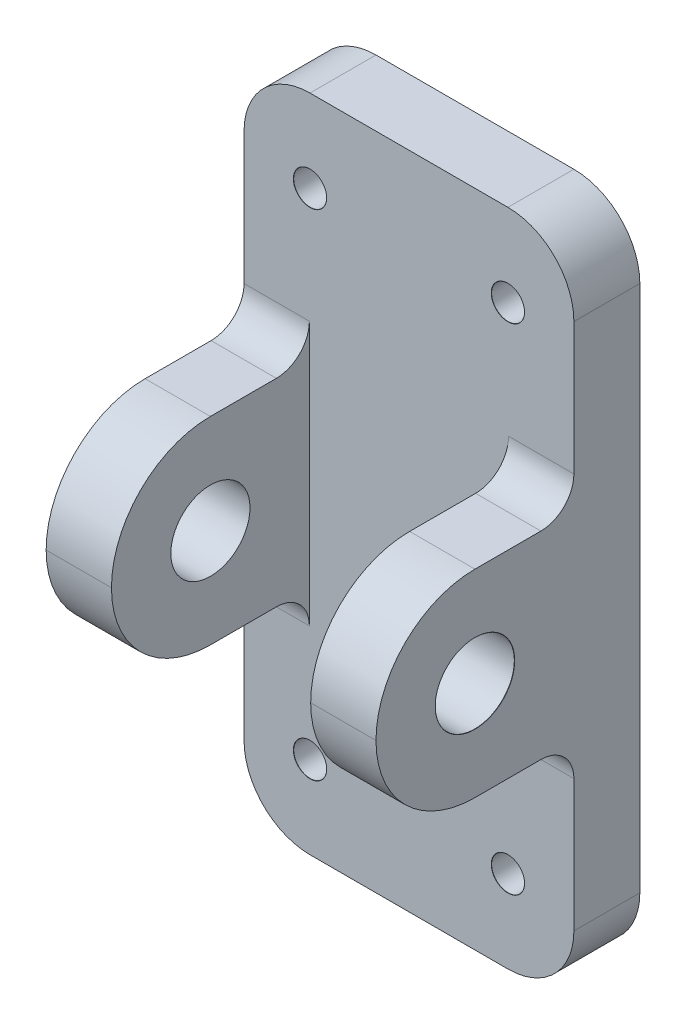
from build123d import *

# Parameters (mm, degrees)
SKETCH1_W                        = 100
SKETCH1_H                        = 50
BOSS_EXTRUDE1_DEPTH              = 10
SKETCH2_W                        = 30
SKETCH2_H                        = 9.9
BOSS_EXTRUDE2_DEPTH              = 30
FILLET1_R                        = 15
F_12_0MM_DOWEL_HOLE1_D           = 12
F_12_0MM_DOWEL_HOLE1_CSINK_D     = 12.05
F_12_0MM_DOWEL_HOLE1_CSINK_ANGLE = 90
F_5_0MM_DOWEL_HOLE1_D            = 5
F_5_0MM_DOWEL_HOLE1_CSINK_D      = 5.05
F_5_0MM_DOWEL_HOLE1_CSINK_ANGLE  = 90
FILLET2_R                        = 5
FILLET3_R                        = 10


with BuildPart() as part:
    # Sketch1 → Boss-Extrude1 (new body)
    with BuildSketch(Plane(origin=(0, 0, 0), x_dir=(0, 1, 0), z_dir=(0, 0, 1))):
        Rectangle(SKETCH1_W, SKETCH1_H)
    extrude(amount=-BOSS_EXTRUDE1_DEPTH)

    # Sketch2 → Boss-Extrude2 (add)
    with BuildSketch(Plane(origin=(0, 0, 0), x_dir=(0, 1, 0), z_dir=(0, 0, 1))):
        with Locations((0, 20.05)):
            Rectangle(SKETCH2_W, SKETCH2_H)
        with Locations((0, -20.05)):
            Rectangle(SKETCH2_W, SKETCH2_H)
    extrude(amount=BOSS_EXTRUDE2_DEPTH)

    # Fillet1
    fillet1_edges = [part.edges().sort_by_distance(p)[0] for p in [
        (20.05, 15, 30),
        (20.05, -15, 30),
        (-20.05, 15, 30),
        (-20.05, -15, 30),
    ]]
    fillet(fillet1_edges, radius=FILLET1_R - 0.0001)  # a hair under: the kernel refuses the full size

    # Ø12.0mm Dowel Hole1 (through all)
    with Locations(Plane.YZ.offset(25)):
        with Locations((0, 15)):
            CounterSinkHole(F_12_0MM_DOWEL_HOLE1_D / 2, F_12_0MM_DOWEL_HOLE1_CSINK_D / 2, counter_sink_angle=F_12_0MM_DOWEL_HOLE1_CSINK_ANGLE)

    # Ø5.0mm Dowel Hole1 (through all)
    with Locations(Plane(origin=(0, 0, 0), x_dir=(0, 1, 0), z_dir=(0, 0, 1))):
        with Locations((37.5, -15), (-37.5, 15), (-37.5, -15), (37.5, 15)):
            CounterSinkHole(F_5_0MM_DOWEL_HOLE1_D / 2, F_5_0MM_DOWEL_HOLE1_CSINK_D / 2, counter_sink_angle=F_5_0MM_DOWEL_HOLE1_CSINK_ANGLE)

    # Fillet2
    fillet2_edges = [part.edges().sort_by_distance(p)[0] for p in [
        (-20.05, -15, 0),
        (-20.05, 15, 0),
        (20.05, -15, 0),
        (20.05, 15, 0),
    ]]
    fillet(fillet2_edges, radius=FILLET2_R)

    # Fillet3
    fillet3_edges = [part.edges().sort_by_distance(p)[0] for p in [
        (-25, -50, -5),
        (-25, 50, -5),
        (25, 50, -5),
        (25, -50, -5),
    ]]
    fillet(fillet3_edges, radius=FILLET3_R)


solid = part.part
